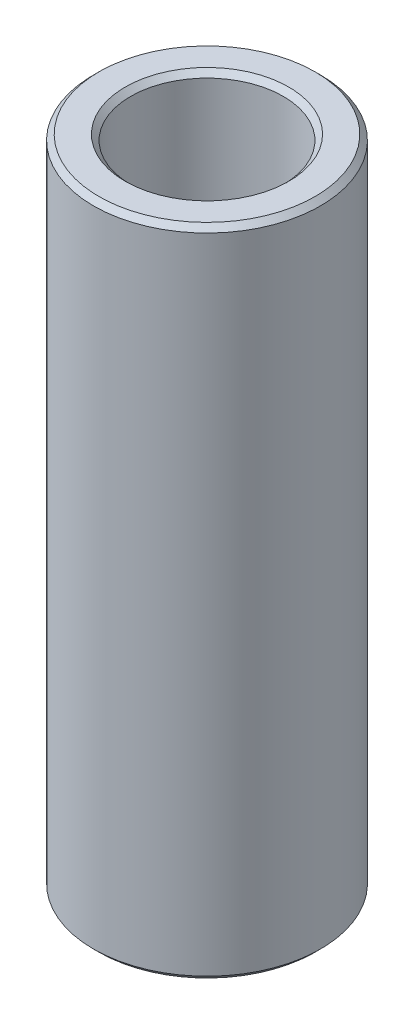
from build123d import *

# Parameters (mm, degrees)
SKETCH1_R           = 57.5
BOSS_EXTRUDE1_DEPTH = 331.619112622
SKETCH2_R           = 38.683075446
CUT_EXTRUDE1_DEPTH  = 342.443605675
CHAMFER1_SIZE       = 2.740041412


with BuildPart() as part:
    # Sketch1 → Boss-Extrude1 (new body)
    with BuildSketch(Plane(origin=(0, 0, 0), x_dir=(1, 0, 0), z_dir=(0, 1, 0))):
        Circle(SKETCH1_R)
    extrude(amount=BOSS_EXTRUDE1_DEPTH)

    # Sketch2 → Cut-Extrude1 (cut, through all)
    with BuildSketch(Plane(origin=(0, 0, 0), x_dir=(1, 0, 0), z_dir=(0, 1, 0))):
        Circle(SKETCH2_R)
    extrude(amount=CUT_EXTRUDE1_DEPTH, mode=Mode.SUBTRACT)

    # Chamfer1
    chamfer1_edges = [part.edges().sort_by_distance(p)[0] for p in [
        (-38.683075446, 331.619112622, 0),
        (-38.683075446, 0, 0),
        (-57.5, 0, 0),
        (-57.5, 331.619112622, 0),
    ]]
    chamfer(chamfer1_edges, length=CHAMFER1_SIZE)


solid = part.part
